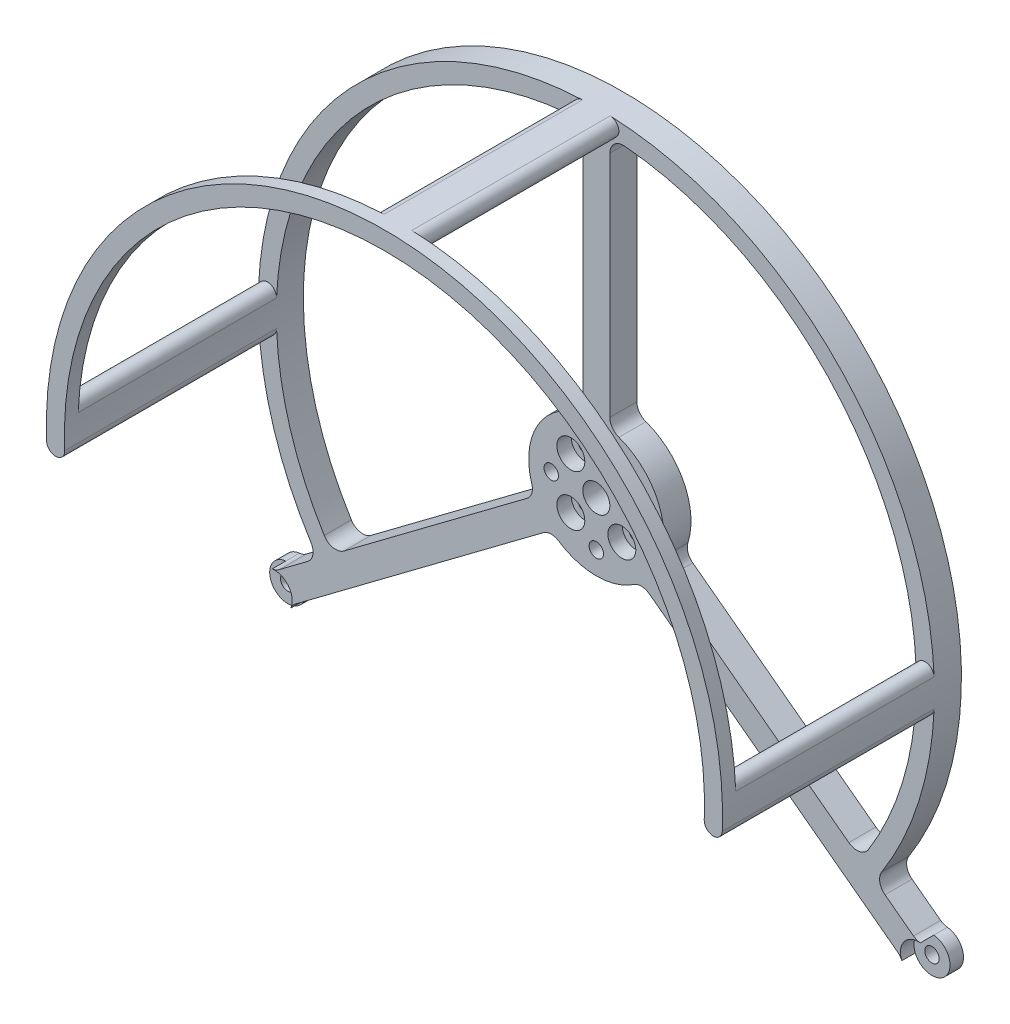
from build123d import *
from build123d.topology import SkipClean

# Parameters (mm, degrees)
SKETCH_1_R          = 15
SKETCH_1_R_2        = 1.6
EXTRUDE_1_DEPTH     = 6
SKETCH_2_R          = 3.1
CUT_EXTRUDE_1_DEPTH = 3.2
SKETCH_4_R          = 3
CUT_EXTRUDE_2_DEPTH = 8
EXTRUDE_3_DEPTH     = 6
SKETCH_5_R          = 1.6
CUT_EXTRUDE_3_DEPTH = 6
SKETCH_6_R          = 4
SKETCH_6_R_2        = 1.6
EXTRUDE_4_DEPTH     = 6
CUT_EXTRUDE_4_DEPTH = 6
EXTRUDE_5_DEPTH     = 6
EXTRUDE_6_DEPTH     = 6
EXTRUDE_7_DEPTH     = 44
EXTRUDE_8_DEPTH     = 3
FILLET_5_R          = 3
CUT_EXTRUDE_START   = -40
CUT_EXTRUDE_5_DEPTH = 40
FILLET_6_R          = 3
CUT_EXTRUDE_START_2 = -3
SKETCH_13_R         = 4
CUT_EXTRUDE_6_DEPTH = 3


with BuildPart() as part:
    # 草图1 → 凸台-拉伸1 (new body)
    with BuildSketch(Plane.XY):
        Circle(SKETCH_1_R)
        with Locations((5.656854249, -5.656854249)):
            Circle(SKETCH_1_R_2, mode=Mode.SUBTRACT)
        with Locations(Location((-5.656854249, -5.656854249, 0), (0, 0, 180))):
            Circle(SKETCH_1_R_2, mode=Mode.SUBTRACT)
        with Locations(Location((5.656854249, 5.656854249, 0), (0, 0, 180))):
            Circle(SKETCH_1_R_2, mode=Mode.SUBTRACT)
        with Locations((-5.656854249, 5.656854249)):
            Circle(SKETCH_1_R_2, mode=Mode.SUBTRACT)
        with Locations((0, -10)):
            Circle(SKETCH_1_R_2, mode=Mode.SUBTRACT)
        with Locations(Location((10, 0, 0), (0, 0, 180))):
            Circle(SKETCH_1_R_2, mode=Mode.SUBTRACT)
        with Locations((-10, 0)):
            Circle(SKETCH_1_R_2, mode=Mode.SUBTRACT)
        with Locations(Location((0, 10, 0), (0, 0, 180))):
            Circle(SKETCH_1_R_2, mode=Mode.SUBTRACT)
    extrude(amount=EXTRUDE_1_DEPTH)

    # 草图2 → 切除-拉伸1 (cut)
    with BuildSketch(Plane.XY.offset(6)):
        with Locations((5.656854249, 5.656854249)):
            Circle(SKETCH_2_R)
        with Locations(Location((5.656854249, -5.656854249, 0), (0, 0, 180))):
            Circle(SKETCH_2_R)
        with Locations((-5.656854249, -5.656854249)):
            Circle(SKETCH_2_R)
        with Locations(Location((-5.656854249, 5.656854249, 0), (0, 0, 180))):
            Circle(SKETCH_2_R)
    extrude(amount=-CUT_EXTRUDE_1_DEPTH, mode=Mode.SUBTRACT)

    # 草图4 → 切除-拉伸2 (cut)
    with BuildSketch(Plane(origin=(0, 0, 0), x_dir=(-1, 0, 0), z_dir=(0, 0, -1))):
        Circle(SKETCH_4_R)
    extrude(amount=-CUT_EXTRUDE_2_DEPTH, mode=Mode.SUBTRACT)

    # 草图3 → 凸台-拉伸3 (add)
    with BuildSketch(Plane(origin=(0, 0, 0), x_dir=(-1, 0, 0), z_dir=(0, 0, -1))):
        with BuildLine():
            Line((76.421330741, -53.505180196), (13.560897996, -6.411087703))
            ThreePointArc((13.560897996, -6.411087703), (12.004694677, -8.993737027), (9.963403186, -11.212965574))
            Line((9.963403186, -11.212965574), (72.82383593, -58.307058067))
            Line((72.82383593, -58.307058067), (76.421330741, -53.505180196))
        make_face()
    extrude_3 = extrude(amount=-EXTRUDE_3_DEPTH)

    # 草图5 → 切除-拉伸3 (cut)
    with BuildSketch(Plane(origin=(0, 0, 0), x_dir=(-1, 0, 0), z_dir=(0, 0, -1))):
        with Locations((71.459945849, -53.536718608)):
            Circle(SKETCH_5_R)
    cut_extrude_3 = extrude(amount=-CUT_EXTRUDE_3_DEPTH, mode=Mode.SUBTRACT)

    # 镜向2: 凸台-拉伸3, 切除-拉伸3 across plane
    add(extrude_3.mirror(Plane(origin=(0, 0, 0), x_dir=(0, 0, 1), z_dir=(1, 0, 0))))
    add(cut_extrude_3.mirror(Plane(origin=(0, 0, 0), x_dir=(0, 0, 1), z_dir=(1, 0, 0))), mode=Mode.SUBTRACT)

    # 草图6 → 凸台-拉伸4 (add)
    # profile 1 of 2: a face of its own
    with BuildSketch(Plane(origin=(0, 0, 0), x_dir=(-1, 0, 0), z_dir=(0, 0, -1))):
        with Locations((-71.459945849, -53.536718608)):
            Circle(SKETCH_6_R)
        with Locations(Location((-71.459945849, -53.536718608, 0), (0, 0, 180))):
            Circle(SKETCH_6_R_2, mode=Mode.SUBTRACT)
    # profile 2 of 2: a face of its own
    with BuildSketch(Plane(origin=(0, 0, 0), x_dir=(-1, 0, 0), z_dir=(0, 0, -1))):
        with Locations((71.459945849, -53.536718608)):
            Circle(SKETCH_6_R)
        with Locations((71.459945849, -53.536718608)):
            Circle(SKETCH_6_R_2, mode=Mode.SUBTRACT)
    extrude(amount=-EXTRUDE_4_DEPTH)

    # 草图7 → 切除-拉伸4 (cut)
    with SkipClean():  # the faces are left unmerged after this step: merging them gives an invalid solid
        with BuildSketch(Plane(origin=(0, 0, 0), x_dir=(-1, 0, 0), z_dir=(0, 0, -1))):
            with BuildLine():
                Line((-75.376122366, -52.722125774), (-79.586843911, -53.536718608))
                Line((-79.586843911, -53.536718608), (-72.314041728, -61.42988757))
                Line((-72.314041728, -61.42988757), (-71.890261821, -57.513504768))
                ThreePointArc((-71.890261821, -57.513504768), (-74.694497967, -55.889944605), (-75.376122366, -52.722125774))
            make_face()
            with BuildLine():
                Line((71.778627556, -57.524003645), (73.252520332, -62.461845531))
                Line((73.252520332, -62.461845531), (79.851137719, -53.043072165))
                Line((79.851137719, -53.043072165), (75.376122366, -52.722125774))
                ThreePointArc((75.376122366, -52.722125774), (74.661197763, -55.935048481), (71.778627556, -57.524003645))
            make_face()
        extrude(amount=-CUT_EXTRUDE_4_DEPTH, mode=Mode.SUBTRACT)

    # 草图8 → 凸台-拉伸5 (add)
    with SkipClean():  # the faces are left unmerged after this step: merging them gives an invalid solid
        with BuildSketch(Plane(origin=(0, 0, 0), x_dir=(-1, 0, 0), z_dir=(0, 0, -1))):
            with BuildLine():
                Line((-58.570222155, -40.131397642), (-61.77418279, -42.531756848))
                ThreePointArc((-61.77418279, -42.531756848), (0, 75), (61.77418279, -42.531756848))
                Line((61.77418279, -42.531756848), (58.570222155, -40.131397642))
                ThreePointArc((58.570222155, -40.131397642), (0, 71), (-58.570222155, -40.131397642))
            make_face()
        extrude(amount=-EXTRUDE_5_DEPTH)

    # 草图9 → 凸台-拉伸6 (add)
    with SkipClean():  # the faces are left unmerged after this step: merging them gives an invalid solid
        with BuildSketch(Plane(origin=(0, 0, 0), x_dir=(-1, 0, 0), z_dir=(0, 0, -1))):
            with BuildLine():
                Line((-3, 14.696938457), (-3, 70.936591404))
                ThreePointArc((-3, 70.936591404), (0, 71), (3, 70.936591404))
                Line((3, 70.936591404), (3, 14.696938457))
                ThreePointArc((3, 14.696938457), (0, 15), (-3, 14.696938457))
            make_face()
        extrude(amount=-EXTRUDE_6_DEPTH)

    # 草图10 → 凸台-拉伸7 (add)
    with SkipClean():  # the faces are left unmerged after this step: merging them gives an invalid solid
        with BuildSketch(Plane.XY.offset(6)):
            with BuildLine():
                ThreePointArc((-74.936640529, 3.082191781), (-75, 0), (-74.936640529, -3.082191781))
                ThreePointArc((-74.936640529, -3.082191781), (-72.856138334, -4.998310414), (-70.940019701, -2.917808219))
                ThreePointArc((-70.940019701, -2.917808219), (-71, 0), (-70.940019701, 2.917808219))
                ThreePointArc((-70.940019701, 2.917808219), (-72.856138334, 4.998310414), (-74.936640529, 3.082191781))
            make_face()
            with BuildLine():
                ThreePointArc((2.917808219, 70.940019701), (0, 71), (-2.917808219, 70.940019701))
                ThreePointArc((-2.917808219, 70.940019701), (-4.998310414, 72.856138334), (-3.082191781, 74.936640529))
                ThreePointArc((-3.082191781, 74.936640529), (0, 75), (3.082191781, 74.936640529))
                ThreePointArc((3.082191781, 74.936640529), (4.998310414, 72.856138334), (2.917808219, 70.940019701))
            make_face()
            with BuildLine():
                ThreePointArc((70.940019701, -2.917808219), (71, 0), (70.940019701, 2.917808219))
                ThreePointArc((70.940019701, 2.917808219), (72.856138334, 4.998310414), (74.936640529, 3.082191781))
                ThreePointArc((74.936640529, 3.082191781), (75, 0), (74.936640529, -3.082191781))
                ThreePointArc((74.936640529, -3.082191781), (72.856138334, -4.998310414), (70.940019701, -2.917808219))
            make_face()
        extrude(amount=EXTRUDE_7_DEPTH)

    # 草图11 → 凸台-拉伸8 (add)
    with SkipClean():  # the faces are left unmerged after this step: merging them gives an invalid solid
        with BuildSketch(Plane.XY.offset(50)):
            with BuildLine():
                ThreePointArc((70.940019701, -2.917808219), (0, 71), (-70.940019701, -2.917808219))
                ThreePointArc((-70.940019701, -2.917808219), (-72.856138334, -4.998310414), (-74.936640529, -3.082191781))
                ThreePointArc((-74.936640529, -3.082191781), (0, 75), (74.936640529, -3.082191781))
                ThreePointArc((74.936640529, -3.082191781), (72.856138334, -4.998310414), (70.940019701, -2.917808219))
            make_face()
        extrude(amount=EXTRUDE_8_DEPTH)

    # 圆角5
    # the kernel refuses this fillet: 3 mm, written as the material it adds along each edge
    with BuildSketch(Plane(origin=(13.560897996, -6.411087703, 0), x_dir=(0.3638350971602613, 0.9314633766683386, 0), z_dir=(0, 0, 1)), Plane(origin=(-3, 14.696938457, 0), x_dir=(-0.96361137499428, -0.2673071603635661, 0), z_dir=(0, 0, 1)), Plane(origin=(-9.963403186, -11.212965574, 0), x_dir=(0.7916938765224899, -0.610918002580373, 0), z_dir=(0, 0, 1))) as fillet_5_piece_1:
        with BuildLine():
            CenterArc((2.283078072, -2.992811711), FILLET_5_R, 93.967130801, 70.528779366)
            Line((-0.607756053, -2.19089023), (0, 0))
            ThreePointArc((0, 0), (1.03776276, -0.035941444), (2.07552552, 0))
        make_face()
    extrude(amount=6)
    with BuildSketch(Plane(origin=(9.963403186, -11.212965574, 0), x_dir=(-0.7916938765224897, -0.6109180025803732, 0), z_dir=(0, 0, 1)), Plane(origin=(3, 14.696938457, 0), x_dir=(0.9636113749942801, -0.2673071603635656, 0), z_dir=(0, 0, 1))) as fillet_5_piece_2:
        with BuildLine():
            CenterArc((2.283078072, 2.992811711), FILLET_5_R, 195.504089834, 70.528779366)
            Line((-0.607756053, 2.19089023), (0, 0))
            ThreePointArc((0, 0), (1.03776276, 0.035941444), (2.07552552, 0))
        make_face()
    extrude(amount=6)
    with BuildSketch(Plane(origin=(67.543769332, -54.351311441, 6), x_dir=(-0.8003129784856748, 0.5995824684456574, 0), z_dir=(0, 0, -1)), Plane(origin=(-71.141264142, -49.54943357, 6), x_dir=(0.8003129784856854, 0.5995824684456432, 0), z_dir=(0, 0, -1))) as fillet_5_piece_3:
        with BuildLine():
            CenterArc((0.959799964, -3), FILLET_5_R, 90, 31.002719134)
            ThreePointArc((-0.585436297, -0.428571429), (-0.282981023, -0.227586802), (0, 0))
            Line((0, 0), (0.959799964, 0))
        make_face()
    extrude(amount=6)
    with BuildSketch(Plane(origin=(71.141264142, -49.54943357, 6), x_dir=(-0.8003129784856889, 0.5995824684456385, 0), z_dir=(0, 0, -1)), Plane(origin=(-67.543769332, -54.351311441, 6), x_dir=(0.8003129784856765, 0.5995824684456551, 0), z_dir=(0, 0, -1))) as fillet_5_piece_4:
        with BuildLine():
            CenterArc((0.959799964, 3), FILLET_5_R, 238.997280866, 31.002719134)
            ThreePointArc((-0.585436297, 0.428571429), (-0.282981023, 0.227586802), (0, 0))
            Line((0, 0), (0.959799964, 0))
        make_face()
    extrude(amount=6)
    with BuildSketch(Plane(origin=(-58.570222155, -40.131397642, 0), x_dir=(0.800312978485684, 0.5995824684456454, 0), z_dir=(0, 0, 1))) as fillet_5_piece_5:
        with BuildLine():
            CenterArc((3.201814516, 3), FILLET_5_R, 174.937907036, 95.062092964)
            ThreePointArc((0.213515536, 3.264705882), (0.087950563, 1.633582954), (0, 0))
            Line((0, 0), (3.201814516, 0))
        make_face()
    extrude(amount=6)
    with BuildSketch(Plane(origin=(58.570222155, -40.131397642, 0), x_dir=(-0.8003129784856812, 0.5995824684456489, 0), z_dir=(0, 0, 1))) as fillet_5_piece_6:
        with BuildLine():
            CenterArc((3.201814516, -3), FILLET_5_R, 90, 95.062092964)
            ThreePointArc((0.213515536, -3.264705882), (0.087950563, -1.633582954), (0, 0))
            Line((0, 0), (3.201814516, 0))
        make_face()
    extrude(amount=6)
    with BuildSketch(Plane(origin=(61.77418279, -42.531756848, 0), x_dir=(0.8003129784856843, -0.599582468445645, 0), z_dir=(0, 0, 1))) as fillet_5_piece_7:
        with BuildLine():
            CenterArc((2.8289124, 3), FILLET_5_R, 184.411725786, 85.588274214)
            ThreePointArc((-0.162198691, 2.769230769), (-0.068295281, 1.385365341), (0, 0))
            Line((0, 0), (2.8289124, 0))
        make_face()
    extrude(amount=6)
    with BuildSketch(Plane(origin=(-61.77418279, -42.531756848, 0), x_dir=(-0.8003129784856826, -0.5995824684456469, 0), z_dir=(0, 0, 1))) as fillet_5_piece_8:
        with BuildLine():
            CenterArc((2.8289124, -3), FILLET_5_R, 90, 85.588274214)
            ThreePointArc((-0.162198691, -2.769230769), (-0.068295281, -1.385365341), (0, 0))
            Line((0, 0), (2.8289124, 0))
        make_face()
    extrude(amount=6)
    with BuildSketch(Plane(origin=(-13.560897996, -6.411087703, 0), x_dir=(-0.8003129784856828, -0.5995824684456466, 0), z_dir=(0, 0, 1))) as fillet_5_piece_9:
        with BuildLine():
            CenterArc((2.273624292, -3), FILLET_5_R, 90, 70.528779366)
            ThreePointArc((-0.554802833, -2), (-0.242767832, -1.009607405), (0, 0))
            Line((0, 0), (2.273624292, 0))
        make_face()
    extrude(amount=6)

    # 草图12 → 切除-拉伸5 (cut)
    with BuildSketch(Plane.XY.offset(6).offset(CUT_EXTRUDE_START)):
        with BuildLine():
            Line((74.557628178, -56.067403137), (72.111653049, -59.061396994))
            Line((72.111653049, -59.061396994), (69.533618756, -58.720186573))
            Line((69.533618756, -58.720186573), (69.741593923, -57.148818642))
            ThreePointArc((69.741593923, -57.148818642), (72.336303632, -57.439537721), (74.557628178, -56.067403137))
        make_face()
    extrude(amount=CUT_EXTRUDE_5_DEPTH, mode=Mode.SUBTRACT)

    # 圆角6
    fillet_6_edges = [part.edges().sort_by_distance(p)[0] for p in [
        (3, 70.936591404, 3),
        (-3, 70.936591404, 3),
    ]]
    fillet(fillet_6_edges, radius=FILLET_6_R)

    # 草图13 → 切除-拉伸6 (cut)
    with BuildSketch(Plane.XY.offset(6).offset(CUT_EXTRUDE_START_2)):
        with Locations((-71.459945849, -53.536718608)):
            Circle(SKETCH_13_R)
        with Locations((71.459945849, -53.536718608)):
            Circle(SKETCH_13_R)
    extrude(amount=CUT_EXTRUDE_6_DEPTH, mode=Mode.SUBTRACT)


solid = part.part
